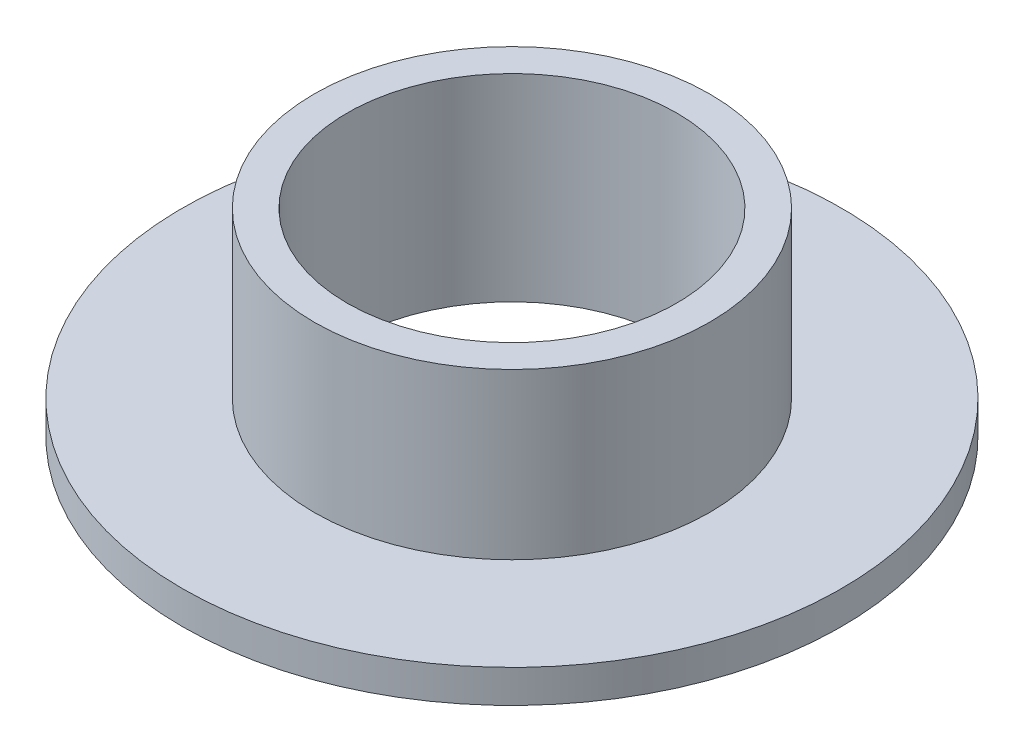
from build123d import *

# Parameters (mm, degrees)
SKETCH1_R           = 50
SKETCH1_R_2         = 25
BOSS_EXTRUDE1_DEPTH = 5
SKETCH2_R           = 30
SKETCH2_R_2         = 25
BOSS_EXTRUDE2_DEPTH = 25


with BuildPart() as part:
    # Sketch1 → Boss-Extrude1 (new body)
    with BuildSketch(Plane(origin=(0, 0, 0), x_dir=(1, 0, 0), z_dir=(0, 1, 0))):
        Circle(SKETCH1_R)
        Circle(SKETCH1_R_2, mode=Mode.SUBTRACT)
    extrude(amount=BOSS_EXTRUDE1_DEPTH)

    # Sketch2 → Boss-Extrude2 (add)
    with BuildSketch(Plane(origin=(0, 5, 0), x_dir=(1, 0, 0), z_dir=(0, 1, 0))):
        Circle(SKETCH2_R)
        Circle(SKETCH2_R_2, mode=Mode.SUBTRACT)
    extrude(amount=BOSS_EXTRUDE2_DEPTH)


solid = part.part
